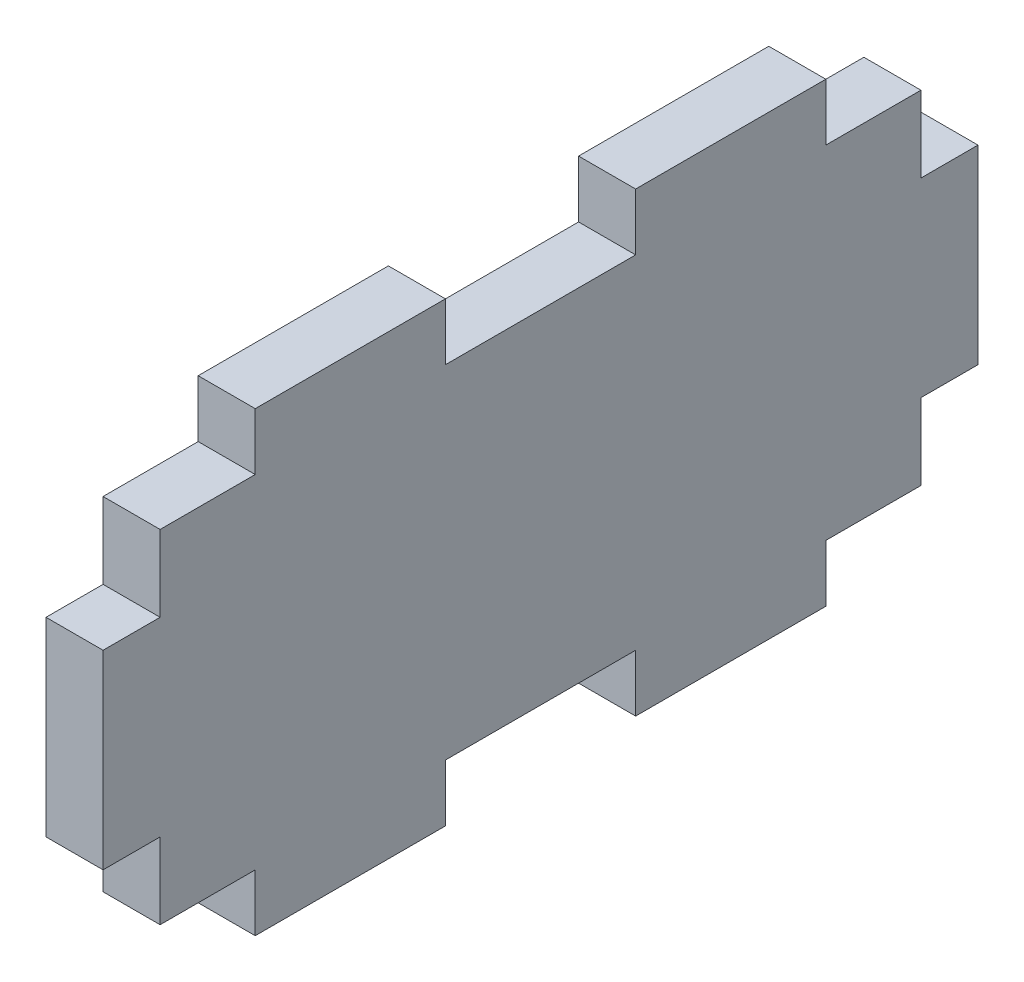
from build123d import *

# Parameters (mm, degrees)
SKETCH1_W               = 46
SKETCH1_H               = 24
BOSS_EXTRUDE1_DEPTH     = 3
SKETCH2_W               = 5
SKETCH2_H               = 3
CUT_EXTRUDE1_DEPTH      = 27.115129714
MIRROR2_COPY_1_SKETCH_W = 5
MIRROR2_COPY_1_SKETCH_H = 3
MIRROR2_COPY_1_DEPTH    = 27.115129714
MIRROR2_COPY_2_SKETCH_W = 5
MIRROR2_COPY_2_SKETCH_H = 3
MIRROR2_COPY_2_DEPTH    = 27.115129714


with BuildPart() as part:
    # Sketch1 → Boss-Extrude1 (new body)
    with BuildSketch(Plane(origin=(0, 0, 0), x_dir=(0, 0, -1), z_dir=(1, 0, 0))):
        Rectangle(SKETCH1_W, SKETCH1_H)
    extrude(amount=BOSS_EXTRUDE1_DEPTH)

    # Sketch2 → Cut-Extrude1 (cut, through all)
    with BuildSketch(Plane(origin=(3, 0, 0), x_dir=(0, 0, -1), z_dir=(1, 0, 0))):
        Polygon((23, 5), (20, 5), (20, 9), (15, 9), (15, 12), (23, 12), align=None)
        with Locations((2.5, 10.5)):
            Rectangle(SKETCH2_W, SKETCH2_H)
    cut_extrude1 = extrude(amount=-CUT_EXTRUDE1_DEPTH, mode=Mode.SUBTRACT)

    # Mirror1: Cut-Extrude1 across plane
    add(cut_extrude1.mirror(Plane.ZX), mode=Mode.SUBTRACT)

    # Mirror2 copy 1 sketch → Mirror2 copy 1 (cut, through all)
    with BuildSketch(Plane(origin=(3, 0, 0), x_dir=(0, 0, 1), z_dir=(1, 0, 0))):
        Polygon((23, 5), (20, 5), (20, 9), (15, 9), (15, 12), (23, 12), align=None)
        with Locations((2.5, 10.5)):
            Rectangle(MIRROR2_COPY_1_SKETCH_W, MIRROR2_COPY_1_SKETCH_H)
    extrude(amount=-MIRROR2_COPY_1_DEPTH, mode=Mode.SUBTRACT)

    # Mirror2 copy 2 sketch → Mirror2 copy 2 (cut, through all)
    with BuildSketch(Plane(origin=(3, 0, 0), x_dir=(0, 0, 1), z_dir=(1, 0, 0))):
        Polygon((23, -5), (20, -5), (20, -9), (15, -9), (15, -12), (23, -12), align=None)
        with Locations((2.5, -10.5)):
            Rectangle(MIRROR2_COPY_2_SKETCH_W, MIRROR2_COPY_2_SKETCH_H)
    extrude(amount=-MIRROR2_COPY_2_DEPTH, mode=Mode.SUBTRACT)


solid = part.part
